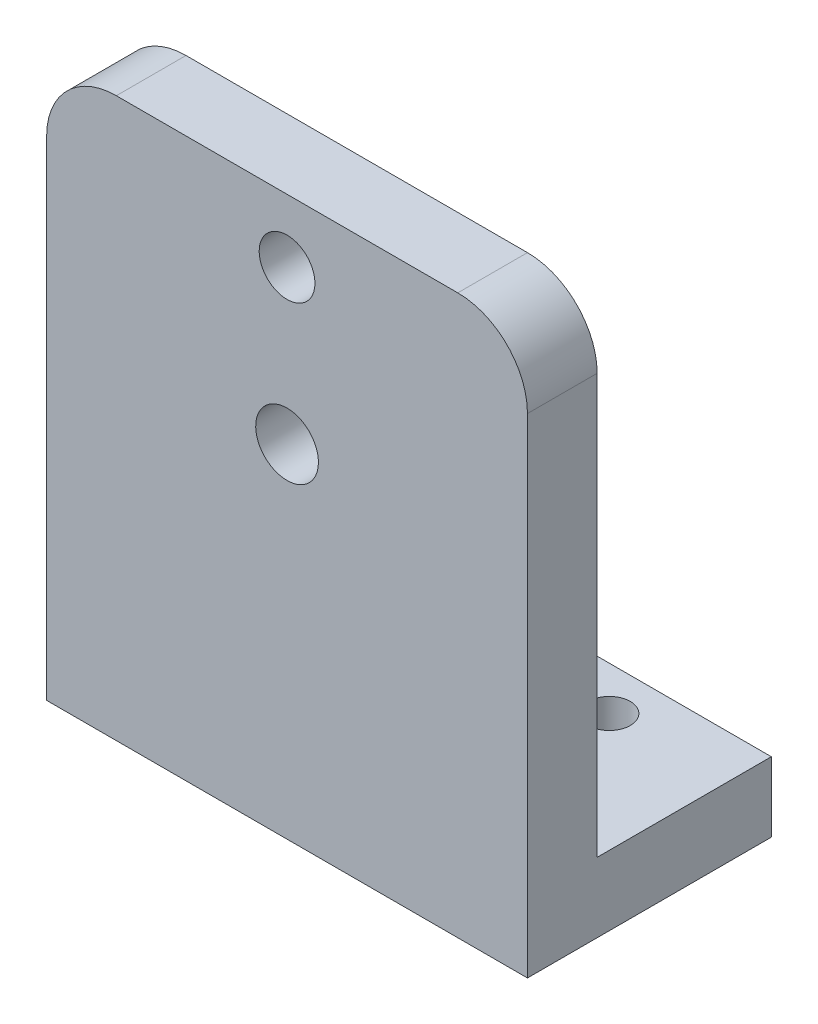
from build123d import *

# Parameters (mm, degrees)
BOSS_EXTRUDE1_DEPTH = 69
SKETCH2_R           = 4
SKETCH2_R_2         = 4.5
CUT_EXTRUDE1_DEPTH  = 109.673927416
SKETCH3_R           = 3
CUT_EXTRUDE2_DEPTH  = 10
FILLET1_R           = 10


with BuildPart() as part:
    # Sketch1 → Boss-Extrude1 (new body)
    with BuildSketch(Plane(origin=(0, 0, 0), x_dir=(0, 0, -1), z_dir=(1, 0, 0))):
        Polygon((0, 80.15), (0, 0), (35, 0), (35, 10), (10, 10), (10, 80.15), align=None)
    extrude(amount=BOSS_EXTRUDE1_DEPTH)

    # Sketch2 → Cut-Extrude1 (cut, through all)
    with BuildSketch(Plane(origin=(0, 0, -10), x_dir=(-1, 0, 0), z_dir=(0, 0, -1))):
        with Locations((-34.5, 71.08)):
            Circle(SKETCH2_R)
        with Locations((-34.5, 49.08)):
            Circle(SKETCH2_R_2)
    extrude(amount=-CUT_EXTRUDE1_DEPTH, mode=Mode.SUBTRACT)

    # Sketch3 → Cut-Extrude2 (cut)
    with BuildSketch(Plane(origin=(0, 10, 0), x_dir=(1, 0, 0), z_dir=(0, 1, 0))):
        with Locations((17, 28.75)):
            Circle(SKETCH3_R)
        with Locations((52, 28.75)):
            Circle(SKETCH3_R)
        with Locations((52, 16.25)):
            Circle(SKETCH3_R)
        with Locations((17, 16.25)):
            Circle(SKETCH3_R)
    extrude(amount=-CUT_EXTRUDE2_DEPTH, mode=Mode.SUBTRACT)

    # Fillet1
    fillet1_edges = [part.edges().sort_by_distance(p)[0] for p in [
        (0, 80.15, -5),
        (69, 80.15, -5),
    ]]
    fillet(fillet1_edges, radius=FILLET1_R)


solid = part.part
